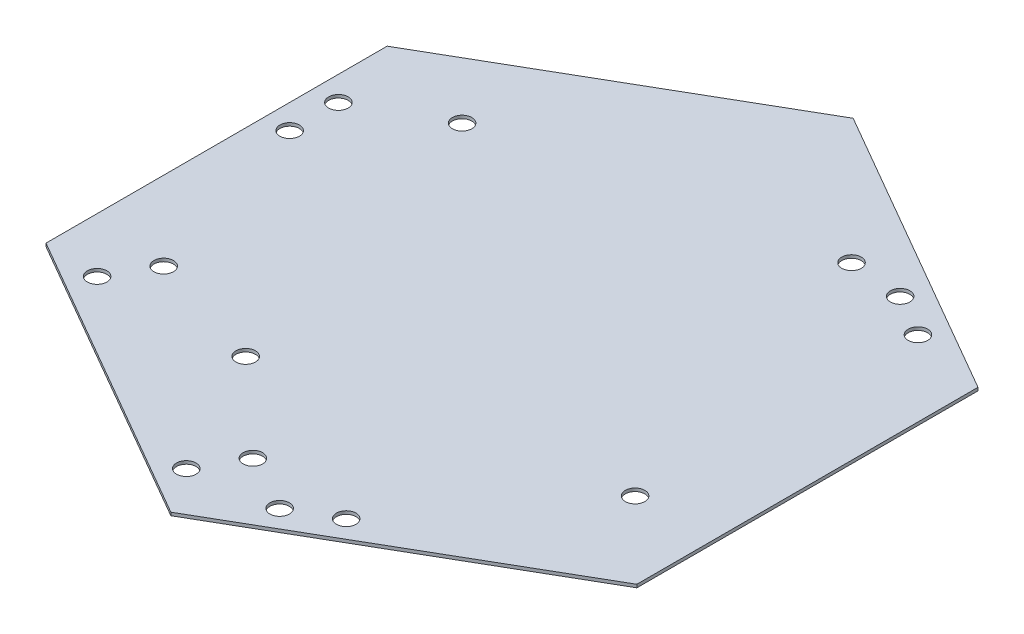
from build123d import *

# Parameters (mm, degrees)
SKETCH1_R           = 2.54
BOSS_EXTRUDE1_DEPTH = 0.8128
SKETCH2_R           = 2.54
CUT_EXTRUDE1_DEPTH  = 118.606454516
SKETCH3_R           = 2.54
CUT_EXTRUDE2_DEPTH  = 118.606454516


with BuildPart() as part:
    # Sketch1 → Boss-Extrude1 (new body)
    with BuildSketch(Plane(origin=(0, 0, 0), x_dir=(1, 0, 0), z_dir=(0, 1, 0))):
        Polygon((0, 88.9), (-76.989658396, 44.45), (-76.989658396, -44.45), (0, -88.9), (76.989658396, -44.45), (76.989658396, 44.45), align=None)
        with Locations((13.322783942, -73.875738686)):
            Circle(SKETCH1_R, mode=Mode.SUBTRACT)
        with Locations((24.32130657, -67.525738686)):
            Circle(SKETCH1_R, mode=Mode.SUBTRACT)
        with Locations((-70.639658396, 12.7)):
            Circle(SKETCH1_R, mode=Mode.SUBTRACT)
        with Locations((-70.639658396, 25.4)):
            Circle(SKETCH1_R, mode=Mode.SUBTRACT)
        with Locations((46.318351826, 54.825738686)):
            Circle(SKETCH1_R, mode=Mode.SUBTRACT)
        with Locations((57.316874454, 48.475738686)):
            Circle(SKETCH1_R, mode=Mode.SUBTRACT)
    extrude(amount=BOSS_EXTRUDE1_DEPTH)

    # Sketch2 → Cut-Extrude1 (cut, through all)
    with BuildSketch(Plane(origin=(0, 0.8128, 0), x_dir=(1, 0, 0), z_dir=(0, 1, 0))):
        with Locations((-49.850334746, 36.846687445)):
            Circle(SKETCH2_R)
        with Locations((-25.4, -43.994090512)):
            Circle(SKETCH2_R)
        with Locations((32.385, 56.092465403)):
            Circle(SKETCH2_R)
        with Locations((56.835334746, -24.748312555)):
            Circle(SKETCH2_R)
    extrude(amount=-CUT_EXTRUDE1_DEPTH, mode=Mode.SUBTRACT)

    # Sketch3 → Cut-Extrude2 (cut, through all)
    with BuildSketch(Plane(origin=(0, 0.8128, 0), x_dir=(1, 0, 0), z_dir=(0, 1, 0))):
        with Locations((-7.823522628, -77.050738686)):
            Circle(SKETCH3_R)
        with Locations((-62.816135768, -45.300738686)):
            Circle(SKETCH3_R)
        with Locations((-56.466135768, -34.302216058)):
            Circle(SKETCH3_R)
        with Locations((-1.473522628, -66.052216058)):
            Circle(SKETCH3_R)
    extrude(amount=-CUT_EXTRUDE2_DEPTH, mode=Mode.SUBTRACT)


solid = part.part
